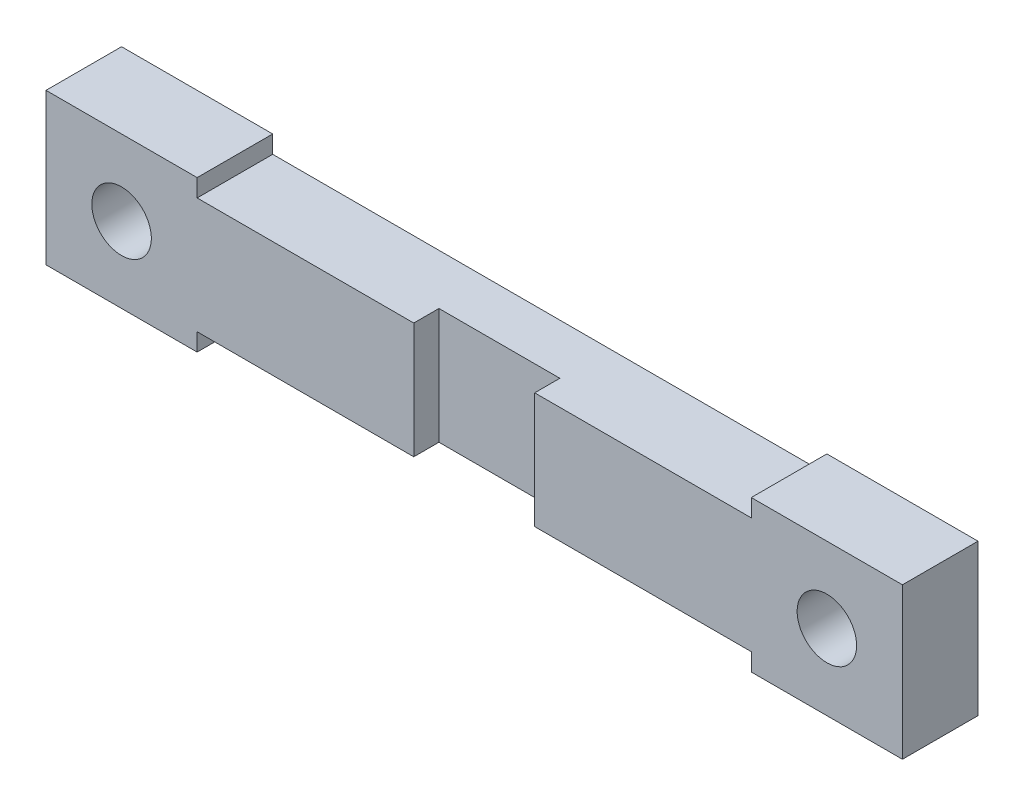
from build123d import *

# Parameters (mm, degrees)
SKETCH1_R           = 1.5
BOSS_EXTRUDE1_DEPTH = 3.81
SKETCH2_W           = 6.096
SKETCH2_H           = 5.842
CUT_EXTRUDE1_DEPTH  = 1.27


with BuildPart() as part:
    # Sketch1 → Boss-Extrude1 (new body)
    with BuildSketch(Plane.XY):
        Polygon((13.97, 2.921), (-13.97, 2.921), (-13.97, 3.81), (-21.59, 3.81), (-21.59, -3.81), (-13.97, -3.81), (-13.97, -2.921), (13.97, -2.921), (13.97, -3.81), (21.59, -3.81), (21.59, 3.81), (13.97, 3.81), align=None)
        with Locations((-17.78, 0)):
            Circle(SKETCH1_R, mode=Mode.SUBTRACT)
        with Locations((17.78, 0)):
            Circle(SKETCH1_R, mode=Mode.SUBTRACT)
    extrude(amount=BOSS_EXTRUDE1_DEPTH)

    # Sketch2 → Cut-Extrude1 (cut)
    with BuildSketch(Plane.XY.offset(3.81)):
        Rectangle(SKETCH2_W, SKETCH2_H)
    extrude(amount=-CUT_EXTRUDE1_DEPTH, mode=Mode.SUBTRACT)


solid = part.part
